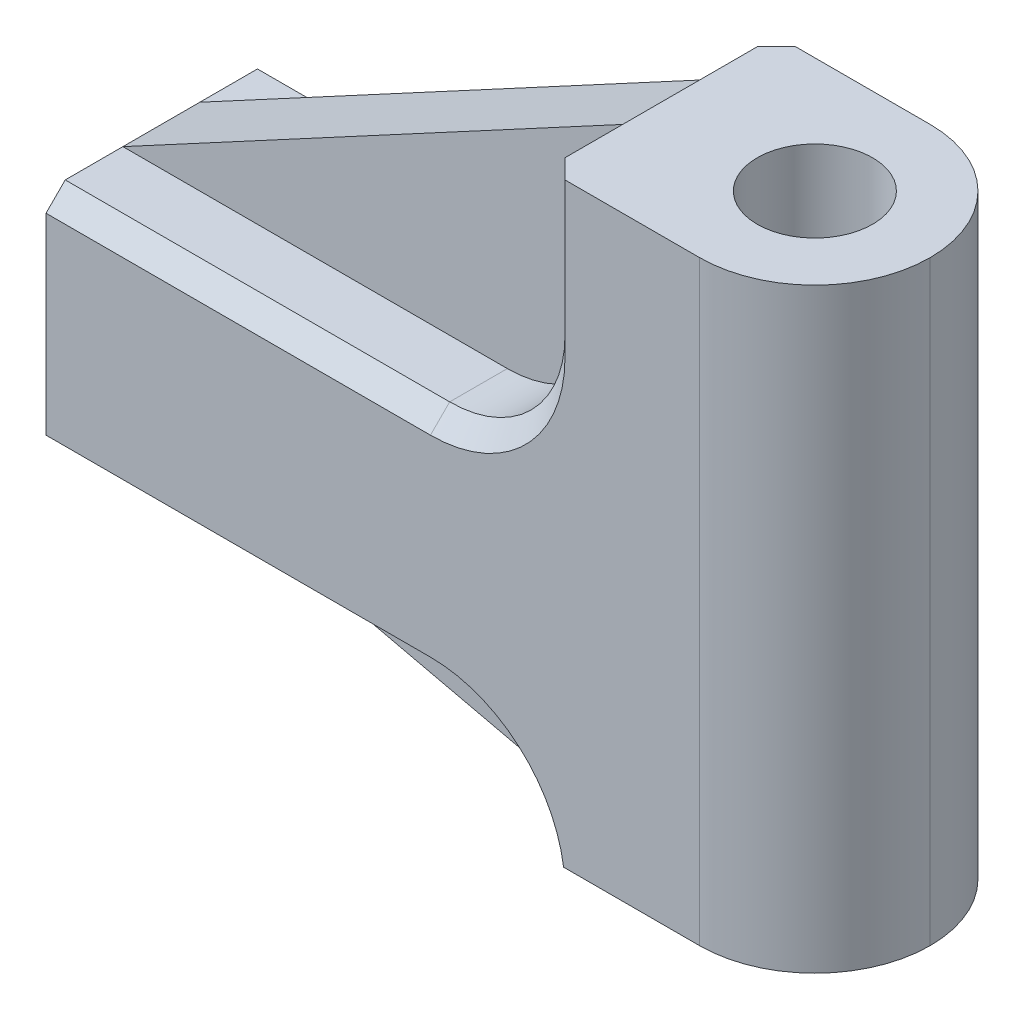
from build123d import *

# Parameters (mm, degrees)
SKETCH1_W               = 7
SKETCH1_H               = 6
BOSS_EXTRUDE1_DEPTH     = 16
FILLET1_R               = 3
SKETCH2_R               = 1.5
CUT_EXTRUDE1_DEPTH      = 16
SKETCH3_W               = 6
SKETCH3_H               = 6
BOSS_EXTRUDE2_DEPTH     = 13
FILLET2_R               = 3
CHAMFER1_SIZE           = 0.5
RIB1_REACH              = 25.179
SKETCH6_WALL_W          = 63.122131006
SKETCH6_WALL_H          = 2
RIB6_REACH              = 25.179
SKETCH7_WALL_W          = 61.69897201
SKETCH7_WALL_H          = 2
SKETCH8_R               = 1.25
CUT_EXTRUDE4_DEPTH      = 15
CUT_EXTRUDE6_DEPTH      = 24.178653973
CUT_EXTRUDE6_DEPTH_BACK = 24.178653973
SKETCH10_W              = 6
SKETCH10_H              = 0.5


with BuildPart() as part:
    # Sketch1 → Boss-Extrude1 (new body)
    with BuildSketch(Plane(origin=(0, 0, 0), x_dir=(1, 0, 0), z_dir=(0, 1, 0))):
        Rectangle(SKETCH1_W, SKETCH1_H)
    extrude(amount=BOSS_EXTRUDE1_DEPTH)

    # Fillet1
    fillet1_edges = [part.edges().sort_by_distance(p)[0] for p in [
        (3.5, 8, 3),
        (3.5, 8, -3),
    ]]
    fillet(fillet1_edges, radius=FILLET1_R - 0.0001)  # a hair under: the kernel refuses the full size

    # Sketch2 → Cut-Extrude1 (cut)
    with BuildSketch(Plane(origin=(0, 16, 0), x_dir=(1, 0, 0), z_dir=(0, 1, 0))):
        with Locations(Location((0.5, 0, 0), (0, 0, 270))):
            Circle(SKETCH2_R)
    extrude(amount=-CUT_EXTRUDE1_DEPTH, mode=Mode.SUBTRACT)

    # Sketch3 → Boss-Extrude2 (add)
    with BuildSketch(Plane.ZY.offset(3.5)):
        with Locations((0, 6)):
            Rectangle(SKETCH3_W, SKETCH3_H)
    extrude(amount=BOSS_EXTRUDE2_DEPTH)

    # Fillet2
    fillet2_edges = [part.edges().sort_by_distance(p)[0] for p in [
        (-3.5, 3, 0),
        (-3.5, 9, 0),
    ]]
    fillet(fillet2_edges, radius=FILLET2_R - 0.0001)  # a hair under: the kernel refuses the full size

    # Chamfer1
    chamfer1_edges = [part.edges().sort_by_distance(p)[0] for p in [
        (-11.49995, 9, -3),
        (-11.49995, 3, -3),
        (-11.49995, 3, 3),
        (-11.49995, 9, 3),
        (-4.378650367, 9.878650367, -3),
        (-4.378650367, 9.878650367, 3),
        (-4.378650367, 2.121349633, 3),
        (-4.378650367, 2.121349633, -3),
        (-3.5, 13.99995, 3),
        (-3.5, 13.99995, -3),
    ]]
    chamfer(chamfer1_edges, length=CHAMFER1_SIZE)

    # Sketch6 wall → Rib1 (add, up to next)
    with BuildSketch(Plane(origin=(-10, 12.5, 0), x_dir=(-0.880471099922, -0.474099823035, 0), z_dir=(-0.474099823035, 0.880471099922, 0)), mode=Mode.PRIVATE) as rib1_sk1:
        Rectangle(SKETCH6_WALL_W, SKETCH6_WALL_H)
    rib1_tool1 = extrude(rib1_sk1.sketch, amount=-RIB1_REACH, mode=Mode.PRIVATE) - part.part
    add(rib1_tool1.solids().sort_by_distance((-10, 12.5, 0))[0])

    # Sketch7 wall → Rib6 (add, up to next)
    with BuildSketch(Plane(origin=(-10, 1.5, 0), x_dir=(-0.974391195695, 0.224859506699, 0), z_dir=(0.224859506699, 0.974391195695, 0)), mode=Mode.PRIVATE) as rib6_sk1:
        Rectangle(SKETCH7_WALL_W, SKETCH7_WALL_H)
    rib6_tool1 = extrude(rib6_sk1.sketch, amount=RIB6_REACH, mode=Mode.PRIVATE) - part.part
    add(rib6_tool1.solids().sort_by_distance((-10, 1.5, 0))[0])

    # Sketch8 → Cut-Extrude4 (cut)
    with BuildSketch(Plane.ZY.offset(16.5)):
        with Locations((0, 6)):
            Circle(SKETCH8_R)
    extrude(amount=-CUT_EXTRUDE4_DEPTH, mode=Mode.SUBTRACT)

    # Sketch10 → Cut-Extrude6 (cut, two sides: drawn at the far end of the back side and taken through both)
    with BuildSketch(Plane(origin=(0, 0, 0), x_dir=(0, 0, -1), z_dir=(1, 0, 0)).offset(-CUT_EXTRUDE6_DEPTH_BACK)):
        with Locations((0, 0.25)):
            Rectangle(SKETCH10_W, SKETCH10_H)
    extrude(amount=CUT_EXTRUDE6_DEPTH + CUT_EXTRUDE6_DEPTH_BACK, mode=Mode.SUBTRACT)


solid = part.part
